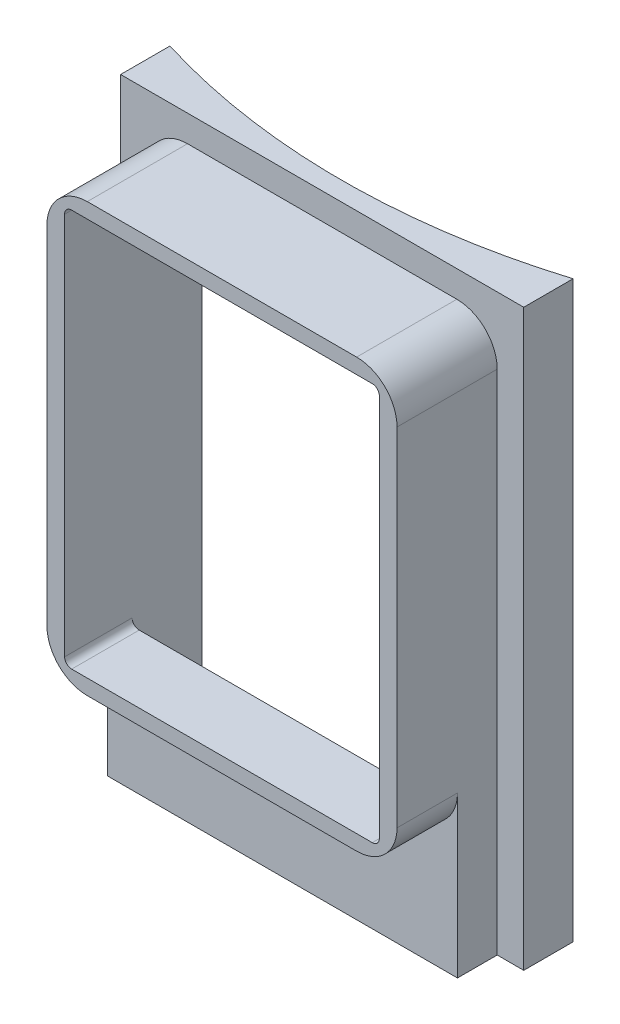
from build123d import *

# Parameters (mm, degrees)
SKETCH1_W           = 144.78
SKETCH1_H           = 206.248
EXTRUDE1_DEPTH      = 252.4252
SKETCH7_W           = 125.73
SKETCH7_H           = 196.723
EXTRUDE5_DEPTH      = 35.98418
EXTRUDE2_DEPTH      = 42.08
EXTRUDE2_DEPTH_BACK = 273.8502
SKETCH4_W           = 113.03
SKETCH4_H           = 142.748
SKETCH10_W          = 113.03
SKETCH10_H          = 2.921
SKETCH10_H_2        = 45.974
EXTRUDE8_DEPTH      = 264.16
SKETCH11_W          = 113.03
SKETCH11_H          = 2.921
EXTRUDE9_DEPTH      = 21.59
FILLET1_R           = 2.54
SKETCH2_R           = 245.618
EXTRUDE4_DEPTH      = 230
SKETCH12_W          = 125.73
SKETCH12_H          = 43.053
EXTRUDE10_DEPTH     = 21.70938
FILLET4_R           = 14.5


with BuildPart() as part:
    # Sketch1 → Extrude1 (new body)
    with BuildSketch(Plane.XY):
        with Locations((25.4, -16.764)):
            Rectangle(SKETCH1_W, SKETCH1_H)
    extrude(amount=EXTRUDE1_DEPTH)

    # Sketch7 → Extrude5 (add)
    with BuildSketch(Plane.XY.offset(252.4252)):
        with Locations((25.4, -21.5265)):
            Rectangle(SKETCH7_W, SKETCH7_H)
    extrude(amount=EXTRUDE5_DEPTH)

    # Sketch4 → Extrude2 (cut, two sides: drawn at the far end of the back side and taken through both)
    with BuildSketch(Plane.XY.offset(252.4252).offset(-EXTRUDE2_DEPTH_BACK)):
        with Locations((25.4, 0)):
            Rectangle(SKETCH4_W, SKETCH4_H)
    extrude(amount=EXTRUDE2_DEPTH + EXTRUDE2_DEPTH_BACK, mode=Mode.SUBTRACT)

    # Sketch10 → Extrude8 (cut)
    with BuildSketch(Plane(origin=(0, 0, 0), x_dir=(-1, 0, 0), z_dir=(0, 0, -1))):
        with Locations((-25.4, 72.8345)):
            Rectangle(SKETCH10_W, SKETCH10_H)
        with Locations((-25.4, -94.361)):
            Rectangle(SKETCH10_W, SKETCH10_H_2)
    extrude(amount=-EXTRUDE8_DEPTH, mode=Mode.SUBTRACT)

    # Sketch11 → Extrude9 (cut)
    with BuildSketch(Plane(origin=(0, 0, 264.16), x_dir=(-1, 0, 0), z_dir=(0, 0, -1))):
        with Locations((-25.4, 72.8345)):
            Rectangle(SKETCH11_W, SKETCH11_H)
    extrude(amount=-EXTRUDE9_DEPTH, mode=Mode.SUBTRACT)

    # Fillet1
    fillet1_edges = [part.edges().sort_by_distance(p)[0] for p in [
        (81.915, -71.374, 276.28469),
        (-31.115, -71.374, 276.28469),
        (81.915, 71.374, 287.07969),
        (-31.115, 71.374, 287.07969),
        (81.915, -117.348, 132.08),
        (-31.115, -117.348, 132.08),
        (-31.115, 74.295, 142.875),
        (81.915, 74.295, 142.875),
    ]]
    fillet(fillet1_edges, radius=FILLET1_R)

    # Sketch2 → Extrude4 (cut)
    with BuildSketch(Plane(origin=(0, 86.36, 0), x_dir=(-1, 0, 0), z_dir=(0, 1, 0))):
        with Locations((-25.4, 0)):
            Circle(SKETCH2_R)
    extrude(amount=-EXTRUDE4_DEPTH, mode=Mode.SUBTRACT)

    # Sketch12 → Extrude10 (cut)
    with BuildSketch(Plane.XY.offset(288.40938)):
        with Locations((25.4, -98.3615)):
            Rectangle(SKETCH12_W, SKETCH12_H)
    extrude(amount=-EXTRUDE10_DEPTH, mode=Mode.SUBTRACT)

    # Fillet4
    fillet4_edges = [part.edges().sort_by_distance(p)[0] for p in [
        (88.265, 76.835, 270.41729),
        (-37.465, -76.835, 277.55469),
        (88.265, -76.835, 277.55469),
        (-37.465, 76.835, 270.41729),
    ]]
    fillet(fillet4_edges, radius=FILLET4_R)


solid = part.part
